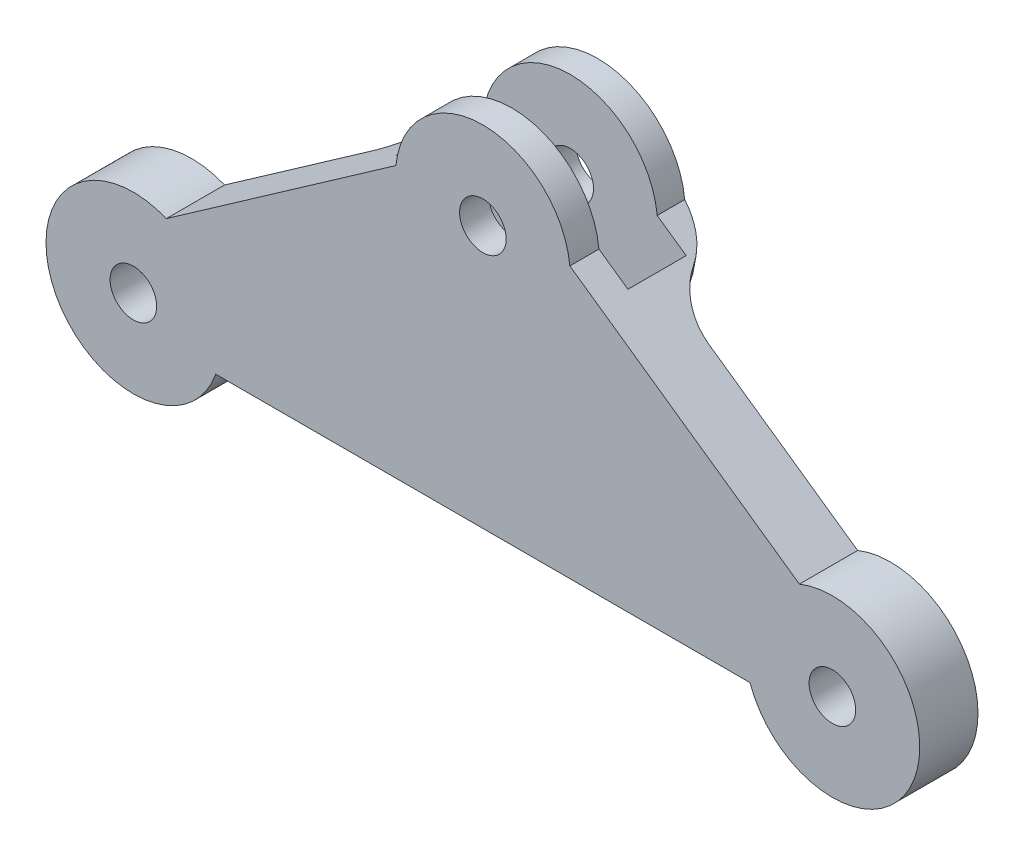
from build123d import *

# Parameters (mm, degrees)
SKETCH1_R               = 4
BOSS_EXTRUDE1_DEPTH     = 20
SKETCH2_R               = 4
CUT_EXTRUDE1_DEPTH      = 10
FILLET2_R               = 10
CUT_EXTRUDE2_DEPTH      = 5
CUT_EXTRUDE2_DEPTH_BACK = 5
SKETCH5_R               = 20


with BuildPart() as part:
    # Sketch1 → Boss-Extrude1 (new body)
    with BuildSketch(Plane.XY):
        with BuildLine():
            Line((5.660747058, 13.890858244), (45.074020085, 41.488329122))
            ThreePointArc((45.074020085, 41.488329122), (60, 55), (74.925979915, 41.488329122))
            Line((74.925979915, 41.488329122), (114.339252942, 13.890858244))
            ThreePointArc((114.339252942, 13.890858244), (133.684102891, -6.143722656), (105.857864376, -5))
            Line((105.857864376, -5), (14.142135624, -5))
            ThreePointArc((14.142135624, -5), (-13.684102891, -6.143722656), (5.660747058, 13.890858244))
        make_face()
        with Locations((60, 40)):
            Circle(SKETCH1_R, mode=Mode.SUBTRACT)
        with Locations((120, 0)):
            Circle(SKETCH1_R, mode=Mode.SUBTRACT)
        Circle(SKETCH1_R, mode=Mode.SUBTRACT)
    extrude(amount=BOSS_EXTRUDE1_DEPTH)

    # Sketch2 → Cut-Extrude1 (cut)
    with BuildSketch(Plane(origin=(0, 0, 0), x_dir=(-1, 0, 0), z_dir=(0, 0, -1))):
        with BuildLine():
            ThreePointArc((-40.099720592, 38.00528712), (-60, 20), (-79.900279408, 38.00528712))
            Line((-79.900279408, 38.00528712), (-114.339252942, 13.890858244))
            ThreePointArc((-114.339252942, 13.890858244), (-133.684102891, -6.143722656), (-105.857864376, -5))
            Line((-105.857864376, -5), (-14.142135624, -5))
            ThreePointArc((-14.142135624, -5), (13.684102891, -6.143722656), (-5.660747058, 13.890858244))
            Line((-5.660747058, 13.890858244), (-40.099720592, 38.00528712))
        make_face()
        with Locations((-120, 0)):
            Circle(SKETCH2_R, mode=Mode.SUBTRACT)
        Circle(SKETCH2_R, mode=Mode.SUBTRACT)
    extrude(amount=-CUT_EXTRUDE1_DEPTH, mode=Mode.SUBTRACT)

    # Fillet2
    fillet2_edges = [part.edges().sort_by_distance(p)[0] for p in [
        (60, 20, 10),
    ]]
    fillet(fillet2_edges, radius=FILLET2_R - 0.0001)  # a hair under: the kernel refuses the full size

    # Fillet3: read off the stored shape, not the designer's step
    # Fillet3 outline → Fillet3 (revolve, cut)
    with BuildSketch(Plane(origin=(60, 40, 0), x_dir=(1, 0, 0), z_dir=(0, -1, 0))):
        with BuildLine():
            Line((21.33974599, 0), (21.33974599, 5.000000048))
            ThreePointArc((21.33974599, 5.000000048), (17.679491948, 1.339745976), (12.679491924, 0))
            Line((12.679491924, 0), (21.33974599, 0))
        make_face()
    revolve(axis=Axis((60, 40, 0), (0, 0, 1)), mode=Mode.SUBTRACT)

    # Sketch5 → Cut-Extrude2 (cut, two sides: drawn at the far end of the back side and taken through both)
    with BuildSketch(Plane.XY.offset(10).offset(-CUT_EXTRUDE2_DEPTH_BACK)):
        with Locations((60, 40)):
            Circle(SKETCH5_R)
    extrude(amount=CUT_EXTRUDE2_DEPTH + CUT_EXTRUDE2_DEPTH_BACK, mode=Mode.SUBTRACT)


solid = part.part
